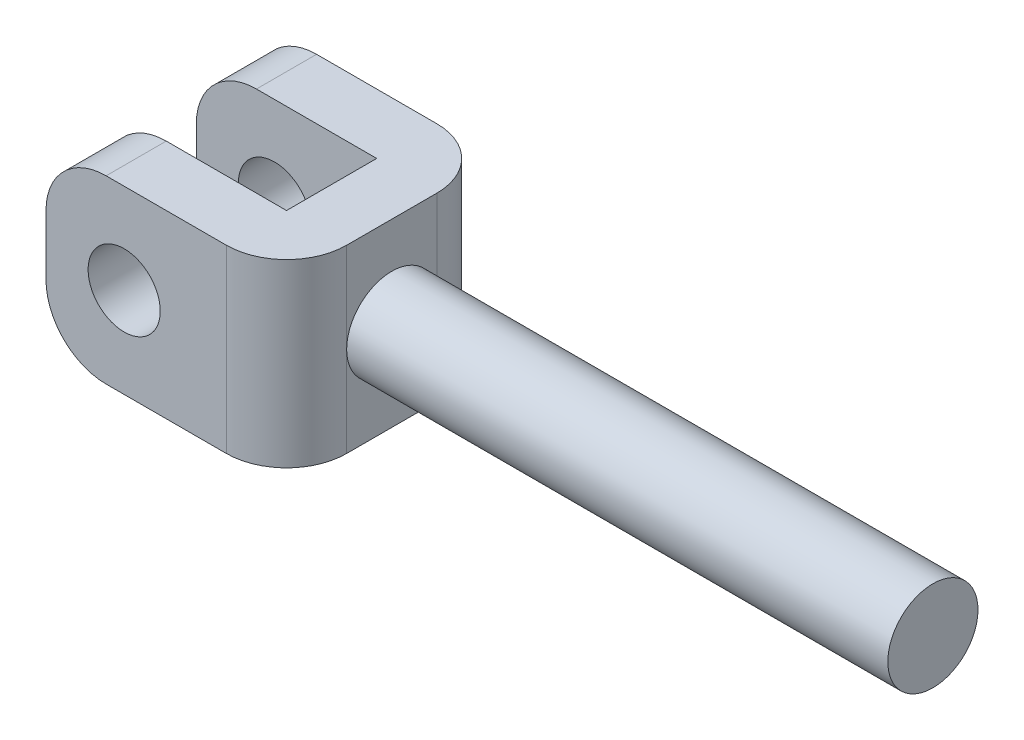
from build123d import *

# Parameters (mm, degrees)
SKETCH1_R                = 0.75
BOSS_EXTRUDE1_DEPTH      = 10
BOSS_EXTRUDE2_DEPTH      = 1.5
BOSS_EXTRUDE2_DEPTH_BACK = 1.5
FILLET1_R                = 1
SKETCH3_R                = 0.6
CUT_EXTRUDE1_DEPTH       = 5


with BuildPart() as part:
    # Sketch1 → Boss-Extrude1 (new body)
    with BuildSketch(Plane(origin=(0, 0, 0), x_dir=(0, 0, -1), z_dir=(1, 0, 0))):
        Circle(SKETCH1_R)
    extrude(amount=BOSS_EXTRUDE1_DEPTH)

    # Sketch2 → Boss-Extrude2 (add, two sides: drawn at the far end of the back side and taken through both)
    with BuildSketch(Plane(origin=(0, 0, 0), x_dir=(1, 0, 0), z_dir=(0, 1, 0)).offset(-BOSS_EXTRUDE2_DEPTH_BACK)):
        Polygon((1, 1.75), (1, -1.75), (-3, -1.75), (-3, -0.75), (0, -0.75), (0, 0.75), (-3, 0.75), (-3, 1.75), align=None)
    extrude(amount=BOSS_EXTRUDE2_DEPTH + BOSS_EXTRUDE2_DEPTH_BACK)

    # Fillet1
    fillet1_edges = [part.edges().sort_by_distance(p)[0] for p in [
        (-3, 1.5, 1.25),
        (-3, 1.5, -1.25),
        (-3, -1.5, -1.25),
        (1, 0, -1.75),
        (1, 0, 1.75),
        (-3, -1.5, 1.25),
    ]]
    fillet(fillet1_edges, radius=FILLET1_R - 0.0001)  # a hair under: the kernel refuses the full size

    # Sketch3 → Cut-Extrude1 (cut)
    with BuildSketch(Plane(origin=(0, 0, -1.75), x_dir=(-1, 0, 0), z_dir=(0, 0, -1))):
        with Locations((1.7, 0)):
            Circle(SKETCH3_R)
    extrude(amount=-CUT_EXTRUDE1_DEPTH, mode=Mode.SUBTRACT)


solid = part.part
